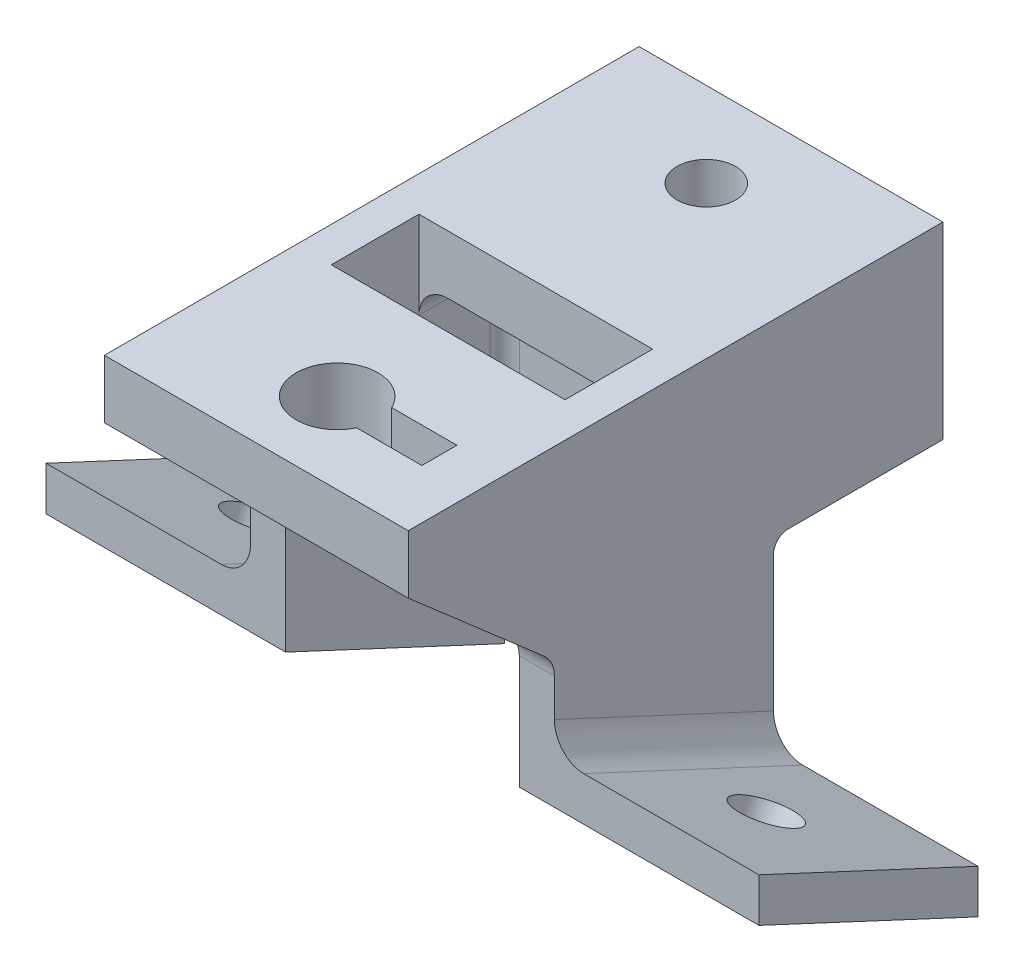
from build123d import *

# Parameters (mm, degrees)
SKETCH1_W           = 26.416
SKETCH1_H           = 31.75
BOSS_EXTRUDE1_DEPTH = 5.08
SKETCH2_W           = 16.51
SKETCH2_H           = 7.62
SKETCH2_W_2         = 3.81
CUT_EXTRUDE1_DEPTH  = 5.08
SKETCH3_W           = 19.05
SKETCH3_H           = 22.098
BOSS_EXTRUDE2_DEPTH = 26.416
BOSS_EXTRUDE3_DEPTH = 3.048
BOSS_EXTRUDE4_DEPTH = 3.048
BOSS_EXTRUDE5_DEPTH = 17.78
BOSS_EXTRUDE6_DEPTH = 17.78
SKETCH10_R          = 2.54
CUT_EXTRUDE3_DEPTH  = 17.78
SKETCH11_W          = 20.32
SKETCH11_H          = 30.981160888
CUT_EXTRUDE4_DEPTH  = 22.86
FILLET3_R           = 2.54
FILLET4_R           = 2.54
SKETCH12_W          = 26.416
SKETCH12_H          = 14.732
SKETCH12_R          = 2.54
BOSS_EXTRUDE7_DEPTH = 16.383
FILLET5_R           = 1.27
FILLET6_R           = 1.27


with BuildPart() as part:
    # Sketch1 → Boss-Extrude1 (new body)
    with BuildSketch(Plane(origin=(0, 0, 0), x_dir=(1, 0, 0), z_dir=(0, 1, 0))):
        with Locations((2.032, 9.525)):
            Rectangle(SKETCH1_W, SKETCH1_H)
        with BuildLine():
            ThreePointArc((5.244874103, -0.8509), (-1.524, 0.6731), (5.244874103, 2.1971))
            Line((5.244874103, 2.1971), (10.922, 2.1971))
            Line((10.922, 2.1971), (10.922, -0.8509))
            Line((10.922, -0.8509), (5.244874103, -0.8509))
        make_face(mode=Mode.SUBTRACT)
    extrude(amount=BOSS_EXTRUDE1_DEPTH)

    # Sketch2 → Cut-Extrude1 (cut)
    with BuildSketch(Plane(origin=(0, 5.08, 0), x_dir=(1, 0, 0), z_dir=(0, 1, 0))):
        with Locations((0.127, 14.1351)):
            Rectangle(SKETCH2_W, SKETCH2_H)
        with Locations((10.287, 14.1351)):
            Rectangle(SKETCH2_W_2, SKETCH2_H)
    extrude(amount=-CUT_EXTRUDE1_DEPTH, mode=Mode.SUBTRACT)

    # Sketch3 → Boss-Extrude2 (add)
    with BuildSketch(Plane.ZY.offset(11.176)):
        with Locations((-15.875, -11.049)):
            Rectangle(SKETCH3_W, SKETCH3_H)
        Polygon((-25.4, -22.098), (-6.35, -22.098), (-25.4, -30.981160888), align=None)
    extrude(amount=-BOSS_EXTRUDE2_DEPTH)

    # Sketch6 → Boss-Extrude3 (add)
    with BuildSketch(Plane.ZY.offset(11.176)):
        Polygon((6.35, 0), (-6.35, -11.049), (-6.35, 0), align=None)
    extrude(amount=-BOSS_EXTRUDE3_DEPTH)

    # Sketch7 → Boss-Extrude4 (add)
    with BuildSketch(Plane(origin=(15.24, 0, 0), x_dir=(0, 0, -1), z_dir=(1, 0, 0))):
        Polygon((-6.35, 0), (6.35, -11.049), (6.35, 0), align=None)
    extrude(amount=-BOSS_EXTRUDE4_DEPTH)

    # Sketch8 → Boss-Extrude5 (add)
    with BuildSketch(Plane(origin=(15.24, 0, 0), x_dir=(0, 0, -1), z_dir=(1, 0, 0))):
        Polygon((6.35, -22.098), (25.4, -30.981160888), (25.4, -27.171160888), (6.35, -18.288), align=None)
    extrude(amount=BOSS_EXTRUDE5_DEPTH)

    # Sketch9 → Boss-Extrude6 (add)
    with BuildSketch(Plane.ZY.offset(11.176)):
        Polygon((-6.35, -22.098), (-25.4, -30.981160888), (-25.4, -27.171160888), (-6.35, -18.288), align=None)
    extrude(amount=BOSS_EXTRUDE6_DEPTH)

    # Sketch10 → Cut-Extrude3 (cut)
    with BuildSketch(Plane(origin=(0, -12.589458796, 5.870561049), x_dir=(1, 0, 0), z_dir=(0, 0.9063077870366494, -0.42261826174070083))):
        with Locations(Location((24.13, 23.993528218, 0), (0, 0, 270))):
            Circle(SKETCH10_R)
        with Locations(Location((-20.066, 23.993528218, 0), (0, 0, 270))):
            Circle(SKETCH10_R)
    extrude(amount=-CUT_EXTRUDE3_DEPTH, mode=Mode.SUBTRACT)

    # Sketch11 → Cut-Extrude4 (cut)
    with BuildSketch(Plane(origin=(0, 0, -25.4), x_dir=(-1, 0, 0), z_dir=(0, 0, -1))):
        with Locations((-2.032, -15.490580444)):
            Rectangle(SKETCH11_W, SKETCH11_H)
    extrude(amount=-CUT_EXTRUDE4_DEPTH, mode=Mode.SUBTRACT)

    # Fillet3
    # the kernel refuses this fillet: 2.54 mm, written as the material it adds along each edge
    with BuildSketch(Plane(origin=(-8.128, 0, -25.4), x_dir=(0, -1, 0), z_dir=(0, 0, 1)), Plane(origin=(12.192, 0, -25.4), x_dir=(-1, 0, 0), z_dir=(0, 0, 1))) as fillet3_piece_1:
        with BuildLine():
            CenterArc((FILLET3_R, FILLET3_R), FILLET3_R, 180, 90)
            Line((0, FILLET3_R), (0, 0))
            Line((0, 0), (FILLET3_R, 0))
        make_face()
    extrude(amount=7.4549)
    with BuildSketch(Plane(origin=(-8.128, 0, -10.3251), x_dir=(1, 0, 0), z_dir=(0, 0, 1))) as fillet3_piece_2_section:
        with BuildLine():
            CenterArc((FILLET3_R, -FILLET3_R), FILLET3_R, 90, 90)
            Line((0, -FILLET3_R), (0, 0))
            Line((0, 0), (FILLET3_R, 0))
        make_face()
    fillet3_piece_2 = extrude(amount=16.6751, mode=Mode.PRIVATE)
    fillet3_piece_2 = split(fillet3_piece_2, bisect_by=Plane(origin=(-7.540337897, -4.52533198, 1.148468989), z_dir=(0, 0.7544430785777146, -0.6563654783626119)), keep=Keep.TOP, mode=Mode.PRIVATE)
    add(fillet3_piece_2)
    with BuildSketch(Plane(origin=(12.192, 0, 6.35), x_dir=(-1, 0, 0), z_dir=(0, 0, -1))) as fillet3_piece_3_section:
        with BuildLine():
            CenterArc((FILLET3_R, -FILLET3_R), FILLET3_R, 90, 90)
            Line((0, -FILLET3_R), (0, 0))
            Line((0, 0), (FILLET3_R, 0))
        make_face()
    fillet3_piece_3 = extrude(amount=16.6751, mode=Mode.PRIVATE)
    fillet3_piece_3 = split(fillet3_piece_3, bisect_by=Plane(origin=(10.504295152, -0.059519406, 0.8509), z_dir=(0, 0, 1)), keep=Keep.TOP, mode=Mode.PRIVATE)
    fillet3_piece_3 = split(fillet3_piece_3, bisect_by=Plane(origin=(10.922, -0.059519406, 3.561570264), z_dir=(-1, 0, 0)), keep=Keep.TOP, mode=Mode.PRIVATE)
    fillet3_piece_3 = split(fillet3_piece_3, bisect_by=Plane(origin=(10.504295152, -1.406445505, 4.733395971), z_dir=(0, 0.7544430785777146, -0.6563654783626119)), keep=Keep.TOP, mode=Mode.PRIVATE)
    add(fillet3_piece_3)
    with BuildSketch(Plane(origin=(12.192, 0, 6.35), x_dir=(-1, 0, 0), z_dir=(0, 0, -1))) as fillet3_piece_4_section:
        with BuildLine():
            CenterArc((FILLET3_R, -FILLET3_R), FILLET3_R, 90, 90)
            Line((0, -FILLET3_R), (0, 0))
            Line((0, 0), (FILLET3_R, 0))
        make_face()
    fillet3_piece_4 = extrude(amount=16.6751, mode=Mode.PRIVATE)
    fillet3_piece_4 = split(fillet3_piece_4, bisect_by=Plane(origin=(11.748492429, -0.576014265, 0.8509), z_dir=(0, 0, 1)), keep=Keep.TOP, mode=Mode.PRIVATE)
    fillet3_piece_4 = split(fillet3_piece_4, bisect_by=Plane(origin=(10.922, -0.576014265, 3.268620732), z_dir=(1, 0, 0)), keep=Keep.TOP, mode=Mode.PRIVATE)
    fillet3_piece_4 = split(fillet3_piece_4, bisect_by=Plane(origin=(11.748492429, -1.774025363, 4.310890388), z_dir=(0, 0.7544430785777146, -0.6563654783626119)), keep=Keep.TOP, mode=Mode.PRIVATE)
    add(fillet3_piece_4)
    with BuildSketch(Plane(origin=(12.192, 0, 6.35), x_dir=(-1, 0, 0), z_dir=(0, 0, -1))) as fillet3_piece_5_section:
        with BuildLine():
            CenterArc((FILLET3_R, -FILLET3_R), FILLET3_R, 90, 90)
            Line((0, -FILLET3_R), (0, 0))
            Line((0, 0), (FILLET3_R, 0))
        make_face()
    fillet3_piece_5 = extrude(amount=16.6751, mode=Mode.PRIVATE)
    fillet3_piece_5 = split(fillet3_piece_5, bisect_by=Plane(origin=(11.774444919, -0.648004952, 0.8509), z_dir=(0, 0, -1)), keep=Keep.TOP, mode=Mode.PRIVATE)
    fillet3_piece_5 = split(fillet3_piece_5, bisect_by=Plane(origin=(10.922, -0.648004952, -0.6731), z_dir=(1, 0, 0)), keep=Keep.TOP, mode=Mode.PRIVATE)
    fillet3_piece_5 = split(fillet3_piece_5, bisect_by=Plane(origin=(11.774444919, -0.648004952, -2.1971), z_dir=(0, 0, 1)), keep=Keep.TOP, mode=Mode.PRIVATE)
    add(fillet3_piece_5)
    with BuildSketch(Plane(origin=(12.192, 0, 6.35), x_dir=(-1, 0, 0), z_dir=(0, 0, -1))) as fillet3_piece_6_section:
        with BuildLine():
            CenterArc((FILLET3_R, -FILLET3_R), FILLET3_R, 90, 90)
            Line((0, -FILLET3_R), (0, 0))
            Line((0, 0), (FILLET3_R, 0))
        make_face()
    fillet3_piece_6 = extrude(amount=16.6751, mode=Mode.PRIVATE)
    fillet3_piece_6 = split(fillet3_piece_6, bisect_by=Plane(origin=(10.922, -0.060981289, -6.2611), z_dir=(-1, 0, 0)), keep=Keep.TOP, mode=Mode.PRIVATE)
    fillet3_piece_6 = split(fillet3_piece_6, bisect_by=Plane(origin=(10.507343007, -0.060981289, -2.1971), z_dir=(0, 0, -1)), keep=Keep.TOP, mode=Mode.PRIVATE)
    add(fillet3_piece_6)
    with BuildSketch(Plane(origin=(12.192, 0, 6.35), x_dir=(-1, 0, 0), z_dir=(0, 0, -1))) as fillet3_piece_7_section:
        with BuildLine():
            CenterArc((FILLET3_R, -FILLET3_R), FILLET3_R, 90, 90)
            Line((0, -FILLET3_R), (0, 0))
            Line((0, 0), (FILLET3_R, 0))
        make_face()
    fillet3_piece_7 = extrude(amount=16.6751, mode=Mode.PRIVATE)
    fillet3_piece_7 = split(fillet3_piece_7, bisect_by=Plane(origin=(10.922, -0.648004952, -6.2611), z_dir=(1, 0, 0)), keep=Keep.TOP, mode=Mode.PRIVATE)
    fillet3_piece_7 = split(fillet3_piece_7, bisect_by=Plane(origin=(11.774444919, -0.648004952, -2.1971), z_dir=(0, 0, -1)), keep=Keep.TOP, mode=Mode.PRIVATE)
    add(fillet3_piece_7)
    with BuildSketch(Plane(origin=(15.24, -29.85478685, -31.155054448), x_dir=(1, 0, 0), z_dir=(0, 0.42261826174070066, 0.9063077870366494))) as fillet3_piece_8_section:
        with BuildLine():
            CenterArc((FILLET3_R, FILLET3_R), FILLET3_R, 180, 90)
            Line((0, FILLET3_R), (0, 0))
            Line((0, 0), (FILLET3_R, 0))
        make_face()
    fillet3_piece_8 = extrude(amount=33.719349356, mode=Mode.PRIVATE)
    fillet3_piece_8 = split(fillet3_piece_8, bisect_by=Plane(origin=(15.81504359, -22.095090044, -25.4), z_dir=(0, 0, 1)), keep=Keep.TOP, mode=Mode.PRIVATE)
    fillet3_piece_8 = split(fillet3_piece_8, bisect_by=Plane(origin=(15.81504359, -22.095090044, -6.35), z_dir=(0, 0, -1)), keep=Keep.TOP, mode=Mode.PRIVATE)
    add(fillet3_piece_8)
    with BuildSketch(Plane(origin=(-11.176, -29.85478685, -31.155054448), x_dir=(0, 0.9063077870366492, -0.4226182617407009), z_dir=(0, 0.4226182617407009, 0.9063077870366493))) as fillet3_piece_9_section:
        with BuildLine():
            CenterArc((FILLET3_R, FILLET3_R), FILLET3_R, 180, 90)
            Line((0, FILLET3_R), (0, 0))
            Line((0, 0), (FILLET3_R, 0))
        make_face()
    fillet3_piece_9 = extrude(amount=33.719349356, mode=Mode.PRIVATE)
    fillet3_piece_9 = split(fillet3_piece_9, bisect_by=Plane(origin=(-11.75104359, -22.095090044, -25.4), z_dir=(0, 0, 1)), keep=Keep.TOP, mode=Mode.PRIVATE)
    fillet3_piece_9 = split(fillet3_piece_9, bisect_by=Plane(origin=(-11.75104359, -22.095090044, -6.35), z_dir=(0, 0, -1)), keep=Keep.TOP, mode=Mode.PRIVATE)
    add(fillet3_piece_9)

    # Fillet4
    fillet4_edges = [part.edges().sort_by_distance(p)[0] for p in [
        (-9.652, -11.049, -6.35),
        (13.716, -11.049, -6.35),
    ]]
    fillet(fillet4_edges, radius=FILLET4_R)

    # Sketch12 → Boss-Extrude7 (add)
    with BuildSketch(Plane(origin=(0, 5.08, 0), x_dir=(1, 0, 0), z_dir=(0, 1, 0))):
        with Locations((2.032, 32.766)):
            Rectangle(SKETCH12_W, SKETCH12_H)
        with Locations(Location((2.032, 32.766, 0), (0, 0, 270))):
            Circle(SKETCH12_R, mode=Mode.SUBTRACT)
    extrude(amount=-BOSS_EXTRUDE7_DEPTH)

    # Fillet5
    fillet5_edges = [part.edges().sort_by_distance(p)[0] for p in [
        (12.192, -6.9215, -25.4),
        (2.032, 0, -25.4),
        (-7.384051224, -0.743948776, -25.4),
        (11.448051224, -0.743948776, -25.4),
        (-8.128, -6.9215, -25.4),
    ]]
    fillet(fillet5_edges, radius=FILLET5_R)

    # Fillet6
    fillet6_edges = [part.edges().sort_by_distance(p)[0] for p in [
        (13.716, -11.303, -25.4),
        (-9.652, -11.303, -25.4),
    ]]
    fillet(fillet6_edges, radius=FILLET6_R)


solid = part.part
